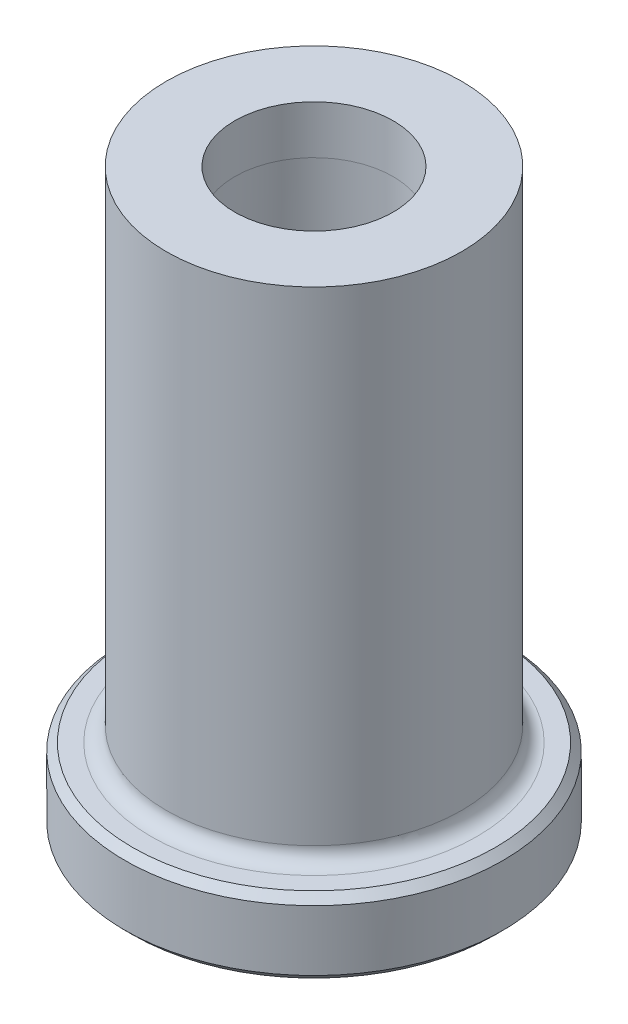
from build123d import *

# Parameters (mm, degrees)
CUT_EXTRUDE1_REACH = 43.911
SKETCH2_R          = 5.24
FILLET2_R          = 1
CHAMFER1_SIZE      = 0.5


# Read off the part's stored shape, not the designer's step: Draft1
with BuildPart() as part:
    # Sketch1 → Revolve1 (revolve)
    with BuildSketch(Plane.XY, mode=Mode.PRIVATE) as revolve1_sk:
        Polygon((0, 0), (9.765, 0), (9.765, -33), (12.5, -33), (12.5, -38), (0, -38), align=None)
    revolve(revolve1_sk.sketch.rotate(Axis((0, 5, 0), (0, -1, 0)), 180), axis=Axis((0, 5, 0), (0, -1, 0)))

    # Sketch2 → Cut-Extrude1 (cut, up to next)
    with BuildSketch(Plane(origin=(0, 0, 0), x_dir=(1, 0, 0), z_dir=(0, 1, 0)), mode=Mode.PRIVATE) as cut_extrude1_sk1:
        with Locations(Location((0, 0, 0), (0, 0, 180))):
            Circle(SKETCH2_R)
    cut_extrude1_tool1 = extrude(cut_extrude1_sk1.sketch, amount=-CUT_EXTRUDE1_REACH, mode=Mode.PRIVATE) & part.part
    add(cut_extrude1_tool1.solids().sort_by_distance((0, 0, 0))[0], mode=Mode.SUBTRACT)

    # Draft1 outline → Draft1 (revolve, cut)
    with BuildSketch(Plane.XY):
        Polygon((5.84743626, -38), (5.24, -3.2), (5.24, -38), align=None)
    revolve(axis=Axis((0, 0, 0), (0, 1, 0)), mode=Mode.SUBTRACT)

    # Fillet2
    fillet2_edges = [part.edges().sort_by_distance(p)[0] for p in [
        (9.765, -33, 0),
    ]]
    fillet(fillet2_edges, radius=FILLET2_R)

    # Chamfer1
    chamfer1_edges = [part.edges().sort_by_distance(p)[0] for p in [
        (12.5, -38, 0),
        (12.5, -33, 0),
    ]]
    chamfer(chamfer1_edges, length=CHAMFER1_SIZE)


solid = part.part
